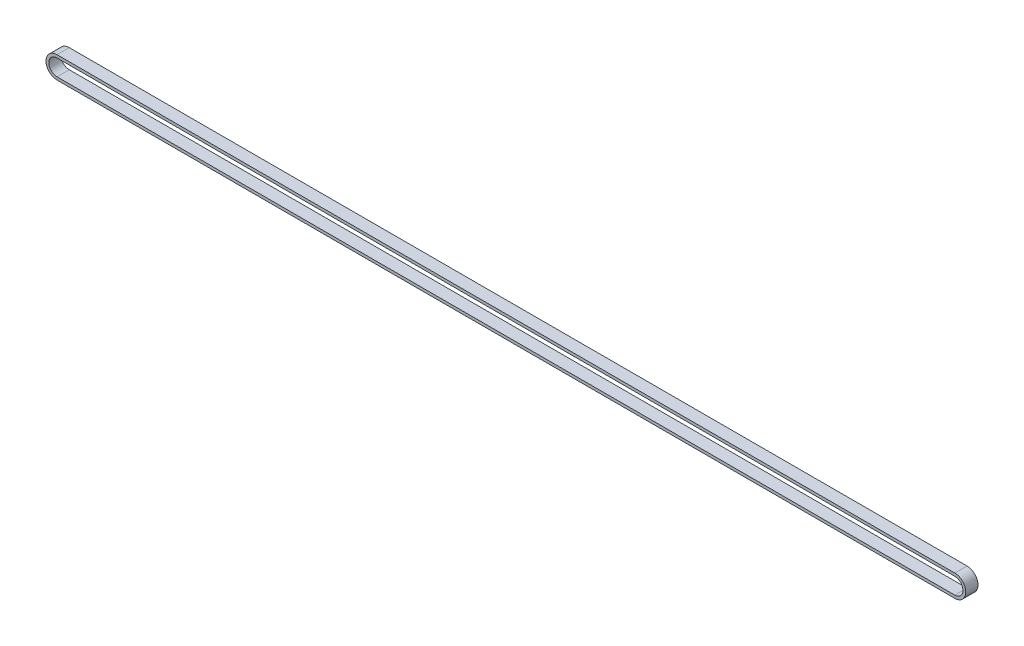
from build123d import *

# Parameters (mm, degrees)
BOSS_EXTRUDE1_DEPTH = 6


with BuildPart() as part:
    # Sketch1 → Boss-Extrude1 (new body)
    with BuildSketch(Plane.XY):
        with BuildLine():
            Line((-220, 5.38), (220, 5.38))
            ThreePointArc((220, 5.38), (225.38, 0), (220, -5.38))
            Line((220, -5.38), (-220, -5.38))
            ThreePointArc((-220, -5.38), (-225.38, 0), (-220, 5.38))
        make_face()
        with BuildLine():
            Line((-220, -4), (220, -4))
            ThreePointArc((220, -4), (224, 0), (220, 4))
            Line((220, 4), (-220, 4))
            ThreePointArc((-220, 4), (-224, 0), (-220, -4))
        make_face(mode=Mode.SUBTRACT)
    extrude(amount=BOSS_EXTRUDE1_DEPTH)


solid = part.part
